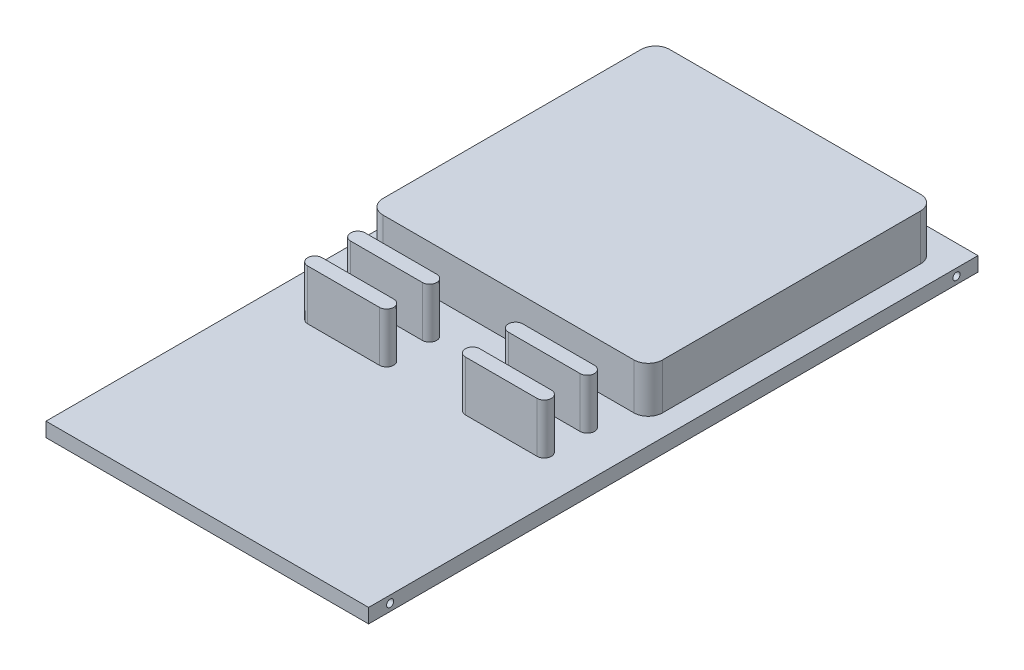
from build123d import *

# Parameters (mm, degrees)
SKETCH1_W           = 57.15
SKETCH1_H           = 107.95
BOSS_EXTRUDE1_DEPTH = 2.54
BOSS_EXTRUDE2_DEPTH = 8.89
SKETCH4_R           = 0.635
CUT_EXTRUDE1_DEPTH  = 10.16
SKETCH5_W           = 49.53
SKETCH5_H           = 50.8
BOSS_EXTRUDE3_DEPTH = 8.128
FILLET1_R           = 2.54


with BuildPart() as part:
    # Sketch1 → Boss-Extrude1 (new body)
    with BuildSketch(Plane(origin=(0, 0, 0), x_dir=(1, 0, 0), z_dir=(0, 1, 0))):
        with Locations((28.575, 53.975)):
            Rectangle(SKETCH1_W, SKETCH1_H)
    extrude(amount=BOSS_EXTRUDE1_DEPTH)

    # Sketch2 → Boss-Extrude2 (add)
    with BuildSketch(Plane(origin=(0, 2.54, 0), x_dir=(1, 0, 0), z_dir=(0, 1, 0))):
        with BuildLine():
            Line((8.255, 40.64), (20.955, 40.64))
            ThreePointArc((20.955, 40.64), (22.225, 39.37), (20.955, 38.1))
            Line((20.955, 38.1), (8.255, 38.1))
            ThreePointArc((8.255, 38.1), (6.985, 39.37), (8.255, 40.64))
        make_face()
        with BuildLine():
            Line((48.895, 40.64), (36.195, 40.64))
            ThreePointArc((36.195, 40.64), (34.925, 39.37), (36.195, 38.1))
            Line((36.195, 38.1), (48.895, 38.1))
            ThreePointArc((48.895, 38.1), (50.165, 39.37), (48.895, 40.64))
        make_face()
        with BuildLine():
            Line((8.255, 48.26), (20.955, 48.26))
            ThreePointArc((20.955, 48.26), (22.225, 46.99), (20.955, 45.72))
            Line((20.955, 45.72), (8.255, 45.72))
            ThreePointArc((8.255, 45.72), (6.985, 46.99), (8.255, 48.26))
        make_face()
        with BuildLine():
            Line((48.895, 48.26), (36.195, 48.26))
            ThreePointArc((36.195, 48.26), (34.925, 46.99), (36.195, 45.72))
            Line((36.195, 45.72), (48.895, 45.72))
            ThreePointArc((48.895, 45.72), (50.165, 46.99), (48.895, 48.26))
        make_face()
    extrude(amount=BOSS_EXTRUDE2_DEPTH)

    # Sketch4 → Cut-Extrude1 (cut)
    with BuildSketch(Plane.ZY):
        with Locations((-104.14, 1.27)):
            Circle(SKETCH4_R)
        with Locations((-3.81, 1.27)):
            Circle(SKETCH4_R)
    cut_extrude1 = extrude(amount=-CUT_EXTRUDE1_DEPTH, mode=Mode.SUBTRACT)

    # Mirror1: Cut-Extrude1 across plane
    add(cut_extrude1.mirror(Plane.ZY.offset(-28.575)), mode=Mode.SUBTRACT)

    # Sketch5 → Boss-Extrude3 (add)
    with BuildSketch(Plane(origin=(0, 2.54, 0), x_dir=(1, 0, 0), z_dir=(0, 1, 0))):
        with Locations((28.575, 78.74)):
            Rectangle(SKETCH5_W, SKETCH5_H)
    extrude(amount=BOSS_EXTRUDE3_DEPTH)

    # Fillet1
    fillet1_edges = [part.edges().sort_by_distance(p)[0] for p in [
        (53.34, 6.604, -53.34),
        (53.34, 6.604, -104.14),
        (3.81, 6.604, -104.14),
        (3.81, 6.604, -53.34),
    ]]
    fillet(fillet1_edges, radius=FILLET1_R)


solid = part.part
